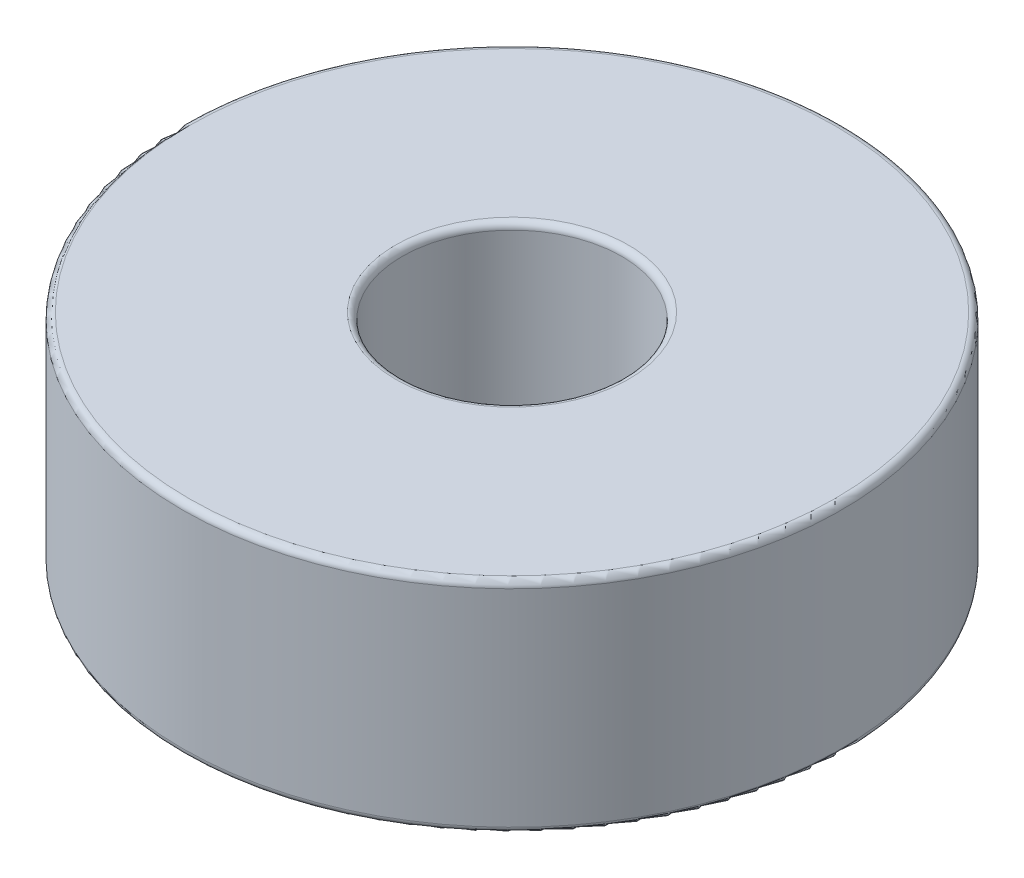
from build123d import *

# Parameters (mm, degrees)
SKETCH1_R               = 15
BOSS_EXTRUDE1_DEPTH     = 10
CUT_EXTRUDE1_DEPTH      = 24.452078799
CUT_EXTRUDE1_DEPTH_BACK = 24.452078799
SKETCH2_R               = 5
FILLET1_R               = 0.3


with BuildPart() as part:
    # Sketch1 → Boss-Extrude1 (new body)
    with BuildSketch(Plane(origin=(0, 0, 0), x_dir=(1, 0, 0), z_dir=(0, 1, 0))):
        Circle(SKETCH1_R)
    extrude(amount=BOSS_EXTRUDE1_DEPTH)

    # Sketch2 → Cut-Extrude1 (cut, two sides: drawn at the far end of the back side and taken through both)
    with BuildSketch(Plane(origin=(0, 10, 0), x_dir=(1, 0, 0), z_dir=(0, 1, 0)).offset(-CUT_EXTRUDE1_DEPTH_BACK)):
        Circle(SKETCH2_R)
    extrude(amount=CUT_EXTRUDE1_DEPTH + CUT_EXTRUDE1_DEPTH_BACK, mode=Mode.SUBTRACT)

    # Fillet1
    fillet1_edges = [part.edges().sort_by_distance(p)[0] for p in [
        (-15, 0, 0),
        (-5, 0, 0),
        (-15, 10, 0),
        (-5, 10, 0),
    ]]
    fillet(fillet1_edges, radius=FILLET1_R)


solid = part.part
